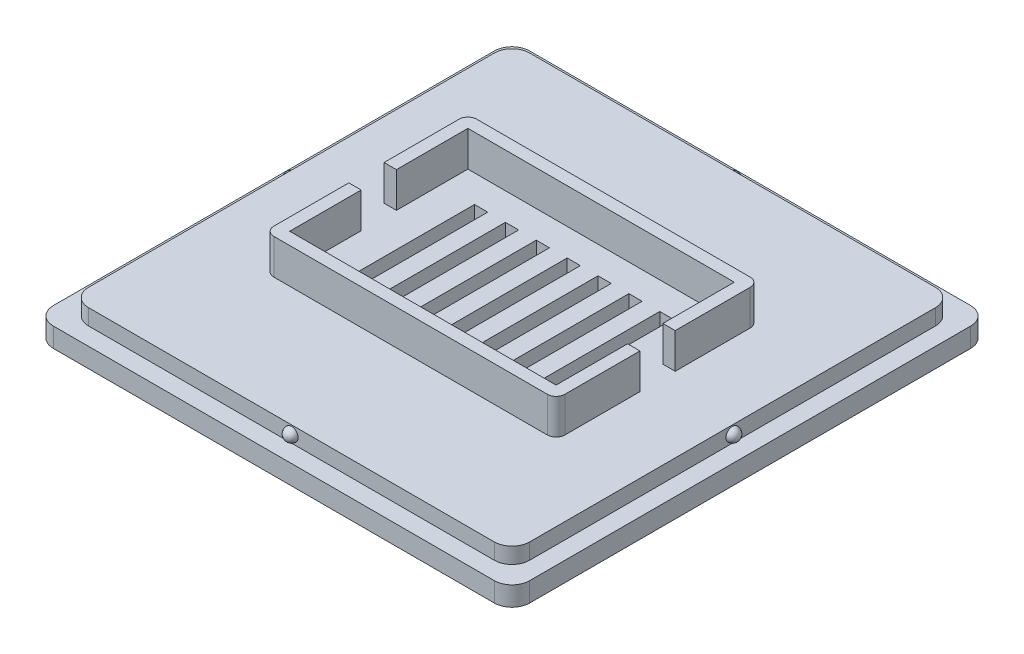
from build123d import *
from build123d.topology import SkipClean

# Parameters (mm, degrees)
SKETCH_1_W          = 54
SKETCH_1_H          = 54
EXTRUDE_2_DEPTH     = 2.2
SKETCH_7_W          = 50
SKETCH_7_H          = 50
EXTRUDE_3_DEPTH     = 1.8
EXTRUDE_5_DEPTH     = 4
SKETCH_9_8_W        = 1.5
SKETCH_9_8_H        = 7
SKETCH_9_8_H_2      = 14
CUT_EXTRUDE_2_DEPTH = 10
FILLET_1_R          = 2
SKETCH_15_W         = 0.001
SKETCH_15_H         = 1.8
REVOLVE_8_ANGLE     = 332


with BuildPart() as part:
    # 草图1 → 凸台-拉伸2 (new body)
    with BuildSketch(Plane(origin=(0, 0, 0), x_dir=(1, 0, 0), z_dir=(0, 1, 0))):
        with Locations((-7.2681601, 9.789048154)):
            Rectangle(SKETCH_1_W, SKETCH_1_H)
    extrude(amount=EXTRUDE_2_DEPTH)

    # 草图7 → 凸台-拉伸3 (add)
    with BuildSketch(Plane(origin=(0, 2.2, 0), x_dir=(1, 0, 0), z_dir=(0, 1, 0))):
        with Locations((-7.2681601, 9.789048154)):
            Rectangle(SKETCH_7_W, SKETCH_7_H)
    extrude(amount=EXTRUDE_3_DEPTH)

    # 草图9 → 凸台-拉伸5 (add)
    with BuildSketch(Plane(origin=(0, 4, 0), x_dir=(1, 0, 0), z_dir=(0, 1, 0))):
        with BuildLine():
            Line((-22.7681601, -1.710951846), (8.2318399, -1.710951846))
            ThreePointArc((8.2318399, -1.710951846), (8.938946681, -1.418058627), (9.2318399, -0.710951846))
            Line((9.2318399, -0.710951846), (9.2318399, 7.789048154))
            Line((9.2318399, 7.789048154), (7.8318399, 7.789048154))
            Line((7.8318399, 7.789048154), (7.8318399, -0.310951846))
            Line((7.8318399, -0.310951846), (-22.3681601, -0.310951846))
            Line((-22.3681601, -0.310951846), (-22.3681601, 7.789048154))
            Line((-22.3681601, 7.789048154), (-23.7681601, 7.789048154))
            Line((-23.7681601, 7.789048154), (-23.7681601, -0.710951846))
            ThreePointArc((-23.7681601, -0.710951846), (-23.475266881, -1.418058627), (-22.7681601, -1.710951846))
        make_face()
        with BuildLine():
            Line((-22.7681601, 21.289048154), (8.2318399, 21.289048154))
            ThreePointArc((8.2318399, 21.289048154), (8.938946681, 20.996154935), (9.2318399, 20.289048154))
            Line((9.2318399, 20.289048154), (9.2318399, 11.789048154))
            Line((9.2318399, 11.789048154), (7.8318399, 11.789048154))
            Line((7.8318399, 11.789048154), (7.8318399, 19.889048154))
            Line((7.8318399, 19.889048154), (-22.3681601, 19.889048154))
            Line((-22.3681601, 19.889048154), (-22.3681601, 11.789048154))
            Line((-22.3681601, 11.789048154), (-23.7681601, 11.789048154))
            Line((-23.7681601, 11.789048154), (-23.7681601, 20.289048154))
            ThreePointArc((-23.7681601, 20.289048154), (-23.475266881, 20.996154935), (-22.7681601, 21.289048154))
        make_face()
    extrude(amount=EXTRUDE_5_DEPTH)

    # 草图9<8> → 切除-拉伸2 (cut)
    with BuildSketch(Plane(origin=(0, 4, 0), x_dir=(1, 0, 0), z_dir=(0, 1, 0))):
        with Locations((-10.7681601, 13.289048154)):
            Rectangle(SKETCH_9_8_W, SKETCH_9_8_H)
        with Locations((-10.7681601, 6.289048154)):
            Rectangle(SKETCH_9_8_W, SKETCH_9_8_H)
        with Locations((-7.2681601, 9.789048154)):
            Rectangle(SKETCH_9_8_W, SKETCH_9_8_H_2)
        with Locations((-14.2681601, 9.789048154)):
            Rectangle(SKETCH_9_8_W, SKETCH_9_8_H_2)
        with Locations((-17.7681601, 9.789048154)):
            Rectangle(SKETCH_9_8_W, SKETCH_9_8_H_2)
        with Locations((-3.7681601, 9.789048154)):
            Rectangle(SKETCH_9_8_W, SKETCH_9_8_H_2)
        with Locations((-0.2681601, 9.789048154)):
            Rectangle(SKETCH_9_8_W, SKETCH_9_8_H_2)
        with Locations((3.2318399, 9.789048154)):
            Rectangle(SKETCH_9_8_W, SKETCH_9_8_H_2)
    extrude(amount=-CUT_EXTRUDE_2_DEPTH, mode=Mode.SUBTRACT)

    # 圆角1
    fillet_1_edges = [part.edges().sort_by_distance(p)[0] for p in [
        (17.7318399, 3.1, 15.210951846),
        (17.7318399, 3.1, -34.789048154),
        (-32.2681601, 3.1, -34.789048154),
        (-32.2681601, 3.1, 15.210951846),
        (-34.2681601, 1.1, -36.789048154),
        (19.7318399, 1.1, -36.789048154),
        (19.7318399, 1.1, 17.210951846),
        (-34.2681601, 1.1, 17.210951846),
    ]]
    fillet(fillet_1_edges, radius=FILLET_1_R)

    # 草图12 → 旋转-薄壁5 (revolve)
    with BuildSketch(Plane.XY.offset(15.210951846)):
        with BuildLine():
            ThreePointArc((-7.2681601, 2.35), (-6.5181601, 3.1), (-7.2681601, 3.85))
            Line((-7.2681601, 3.85), (-7.2681601, 3.851))
            ThreePointArc((-7.2681601, 3.851), (-6.5171601, 3.1), (-7.2681601, 2.349))
            Line((-7.2681601, 2.349), (-7.2681601, 2.35))
        make_face()
    revolve(axis=Axis((-7.2681601, 4, 15.210951846), (0, -1, 0)))

    # 草图13 → 旋转-薄壁6 (revolve)
    with BuildSketch(Plane.ZY.offset(32.2681601)):
        with BuildLine():
            ThreePointArc((-9.789048154, 2.35), (-9.039048154, 3.1), (-9.789048154, 3.85))
            Line((-9.789048154, 3.85), (-9.789048154, 3.851))
            ThreePointArc((-9.789048154, 3.851), (-9.038048154, 3.1), (-9.789048154, 2.349))
            Line((-9.789048154, 2.349), (-9.789048154, 2.35))
        make_face()
    revolve(axis=Axis((-32.2681601, 4, -9.789048154), (0, -1, 0)))

    # 草图15 → 旋转-薄壁8 (revolve)
    with SkipClean():  # the faces are left unmerged after this step: merging them gives an invalid solid
        with BuildSketch(Plane(origin=(17.7318399, 0, 0), x_dir=(0, 0, -1), z_dir=(1, 0, 0))):
            with Locations((9.788548154, 3.1)):
                Rectangle(SKETCH_15_W, SKETCH_15_H)
            with BuildLine():
                ThreePointArc((9.789048154, 2.35), (10.539048154, 3.1), (9.789048154, 3.85))
                Line((9.789048154, 3.85), (9.789048154, 3.851))
                ThreePointArc((9.789048154, 3.851), (10.540048154, 3.1), (9.789048154, 2.349))
                Line((9.789048154, 2.349), (9.789048154, 2.35))
            make_face()
        revolve(axis=Axis((17.7318399, 4, -9.789048154), (0, -1, 0)), revolution_arc=REVOLVE_8_ANGLE)
    add(part.part.scale(1), mode=Mode.REPLACE)  # the faces are merged on a copy

    # 草图16 → 旋转-薄壁9 (revolve)
    with BuildSketch(Plane(origin=(0, 0, -34.789048154), x_dir=(-1, 0, 0), z_dir=(0, 0, -1))):
        with BuildLine():
            ThreePointArc((7.2681601, 3.85), (6.5181601, 3.1), (7.2681601, 2.35))
            Line((7.2681601, 2.35), (7.2681601, 2.349))
            ThreePointArc((7.2681601, 2.349), (6.5171601, 3.1), (7.2681601, 3.851))
            Line((7.2681601, 3.851), (7.2681601, 3.85))
        make_face()
    revolve(axis=Axis((-7.2681601, 4, -34.789048154), (0, -1, 0)))


solid = part.part
